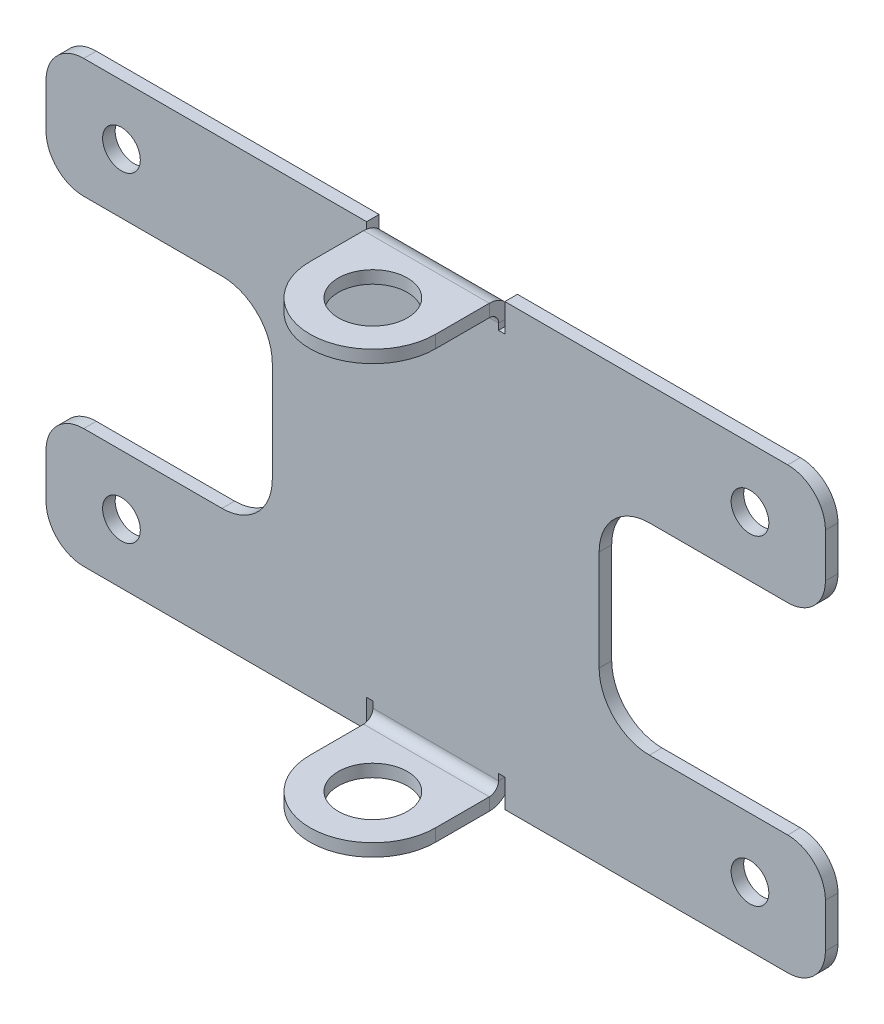
from build123d import *

# Parameters (mm, degrees)
SKETCH1_R                     = 1.5
BASE_FLANGE1_DEPTH            = 1
EDGE_FLANGE1_STRIP_W          = 5.4732
EDGE_FLANGE1_STRIP_H          = 1
EDGE_FLANGE1_STRIP_CUT_DEPTH  = 10
EDGE_FLANGE1_RELIEF_W         = 5.9732
EDGE_FLANGE1_RELIEF_H         = 0.5
EDGE_FLANGE1_RELIEF_CUT_DEPTH = 1
EDGE_FLANGE1_DEPTH            = 10
EDGE_FLANGE1_PROFILE_R        = 2.75
EDGE_FLANGE1_FLAT_DEPTH       = 1
EDGE_FLANGE2_STRIP_W          = 5.4732
EDGE_FLANGE2_STRIP_H          = 1
EDGE_FLANGE2_STRIP_CUT_DEPTH  = 10
EDGE_FLANGE2_RELIEF_W         = 5.9732
EDGE_FLANGE2_RELIEF_H         = 0.5
EDGE_FLANGE2_RELIEF_CUT_DEPTH = 1
EDGE_FLANGE2_DEPTH            = 10
EDGE_FLANGE2_PROFILE_R        = 2.75
EDGE_FLANGE2_FLAT_DEPTH       = 1


# Sheet-metal steps are written as plain solids
with BuildPart() as part:
    # Sketch1 → Base-Flange1 (new body)
    with BuildSketch(Plane.XY):
        with BuildLine():
            Line((-28, 8), (-17, 8))
            ThreePointArc((-17, 8), (-14.171572875, 6.828427125), (-13, 4))
            Line((-13, 4), (-13, -4))
            ThreePointArc((-13, -4), (-14.171572875, -6.828427125), (-17, -8))
            Line((-17, -8), (-28, -8))
            ThreePointArc((-28, -8), (-30.121320344, -8.878679656), (-31, -11))
            Line((-31, -11), (-31, -14.5))
            ThreePointArc((-31, -14.5), (-30.121320344, -16.621320344), (-28, -17.5))
            Line((-28, -17.5), (28, -17.5))
            ThreePointArc((28, -17.5), (30.121320344, -16.621320344), (31, -14.5))
            Line((31, -14.5), (31, -11))
            ThreePointArc((31, -11), (30.121320344, -8.878679656), (28, -8))
            Line((28, -8), (17, -8))
            ThreePointArc((17, -8), (14.171572875, -6.828427125), (13, -4))
            Line((13, -4), (13, 4))
            ThreePointArc((13, 4), (14.171572875, 6.828427125), (17, 8))
            Line((17, 8), (28, 8))
            ThreePointArc((28, 8), (30.121320344, 8.878679656), (31, 11))
            Line((31, 11), (31, 14.5))
            ThreePointArc((31, 14.5), (30.121320344, 16.621320344), (28, 17.5))
            Line((28, 17.5), (-28, 17.5))
            ThreePointArc((-28, 17.5), (-30.121320344, 16.621320344), (-31, 14.5))
            Line((-31, 14.5), (-31, 11))
            ThreePointArc((-31, 11), (-30.121320344, 8.878679656), (-28, 8))
        make_face()
        with Locations((-25, 12.75)):
            Circle(SKETCH1_R, mode=Mode.SUBTRACT)
        with Locations((25, 12.75)):
            Circle(SKETCH1_R, mode=Mode.SUBTRACT)
        with Locations((25, -12.75)):
            Circle(SKETCH1_R, mode=Mode.SUBTRACT)
        with Locations((-25, -12.75)):
            Circle(SKETCH1_R, mode=Mode.SUBTRACT)
    extrude(amount=-BASE_FLANGE1_DEPTH)

    # Edge-Flange1 strip (across the edge) → Edge-Flange1 strip cut (cut)
    with BuildSketch(Plane(origin=(5, 17.5, 0), x_dir=(0, -1, 0), z_dir=(-1, 0, 0))):
        with Locations((-1, -0.5)):
            Rectangle(EDGE_FLANGE1_STRIP_W, EDGE_FLANGE1_STRIP_H)
    extrude(amount=EDGE_FLANGE1_STRIP_CUT_DEPTH, mode=Mode.SUBTRACT)

    # Edge-Flange1 relief (on the sheet) → Edge-Flange1 relief cut (cut)
    with BuildSketch(Plane(origin=(5, 15.7634, 0), x_dir=(0, -1, 0), z_dir=(0, 0, 1))):
        with Locations((-2.4866, 0.25)):
            Rectangle(EDGE_FLANGE1_RELIEF_W, EDGE_FLANGE1_RELIEF_H)
        with Locations((-2.4866, -10.25)):
            Rectangle(EDGE_FLANGE1_RELIEF_W, EDGE_FLANGE1_RELIEF_H)
    extrude(amount=-EDGE_FLANGE1_RELIEF_CUT_DEPTH, mode=Mode.SUBTRACT)

    # Edge-Flange1 bend section (across the edge) → Edge-Flange1 (add)
    with BuildSketch(Plane(origin=(5, 17.5, 0), x_dir=(0, -1, 0), z_dir=(-1, 0, 0))):
        with BuildLine():
            Line((0, 0.7366), (1, 0.7366))
            ThreePointArc((1, 0.7366), (1.215745145, 0.215745145), (1.7366, 0))
            Line((1.7366, 0), (1.7366, -1))
            ThreePointArc((1.7366, -1), (0.508638364, -0.491361636), (0, 0.7366))
        make_face()
    extrude(amount=EDGE_FLANGE1_DEPTH)

    # Edge-Flange1 profile (on flange) → Edge-Flange1 flat (add)
    with BuildSketch(Plane(origin=(0, 17.5, 0), x_dir=(-1, 0, 0), z_dir=(0, 1, 0))):
        with BuildLine():
            Line((-5, 5), (-5, 0.7366))
            Line((-5, 0.7366), (5, 0.7366))
            Line((5, 0.7366), (5, 5))
            ThreePointArc((5, 5), (0, 10), (-5, 5))
        make_face()
        with Locations((0, 5)):
            Circle(EDGE_FLANGE1_PROFILE_R, mode=Mode.SUBTRACT)
    extrude(amount=-EDGE_FLANGE1_FLAT_DEPTH)

    # Edge-Flange2 strip (across the edge) → Edge-Flange2 strip cut (cut)
    with BuildSketch(Plane(origin=(-5, -17.5, 0), x_dir=(0, 1, 0), z_dir=(1, 0, 0))):
        with Locations((-1, -0.5)):
            Rectangle(EDGE_FLANGE2_STRIP_W, EDGE_FLANGE2_STRIP_H)
    extrude(amount=EDGE_FLANGE2_STRIP_CUT_DEPTH, mode=Mode.SUBTRACT)

    # Edge-Flange2 relief (on the sheet) → Edge-Flange2 relief cut (cut)
    with BuildSketch(Plane(origin=(-5, -15.7634, 0), x_dir=(0, 1, 0), z_dir=(0, 0, 1))):
        with Locations((-2.4866, 0.25)):
            Rectangle(EDGE_FLANGE2_RELIEF_W, EDGE_FLANGE2_RELIEF_H)
        with Locations((-2.4866, -10.25)):
            Rectangle(EDGE_FLANGE2_RELIEF_W, EDGE_FLANGE2_RELIEF_H)
    extrude(amount=-EDGE_FLANGE2_RELIEF_CUT_DEPTH, mode=Mode.SUBTRACT)

    # Edge-Flange2 bend section (across the edge) → Edge-Flange2 (add)
    with BuildSketch(Plane(origin=(-5, -17.5, 0), x_dir=(0, 1, 0), z_dir=(1, 0, 0))):
        with BuildLine():
            Line((0, 0.7366), (1, 0.7366))
            ThreePointArc((1, 0.7366), (1.215745145, 0.215745145), (1.7366, 0))
            Line((1.7366, 0), (1.7366, -1))
            ThreePointArc((1.7366, -1), (0.508638364, -0.491361636), (0, 0.7366))
        make_face()
    extrude(amount=EDGE_FLANGE2_DEPTH)

    # Edge-Flange2 profile (on flange) → Edge-Flange2 flat (add)
    with BuildSketch(Plane.XZ.offset(17.5)):
        with BuildLine():
            ThreePointArc((5, 5), (0, 10), (-5, 5))
            Line((-5, 5), (-5, 0.7366))
            Line((-5, 0.7366), (5, 0.7366))
            Line((5, 0.7366), (5, 5))
        make_face()
        with Locations((0, 5)):
            Circle(EDGE_FLANGE2_PROFILE_R, mode=Mode.SUBTRACT)
    extrude(amount=-EDGE_FLANGE2_FLAT_DEPTH)


solid = part.part
